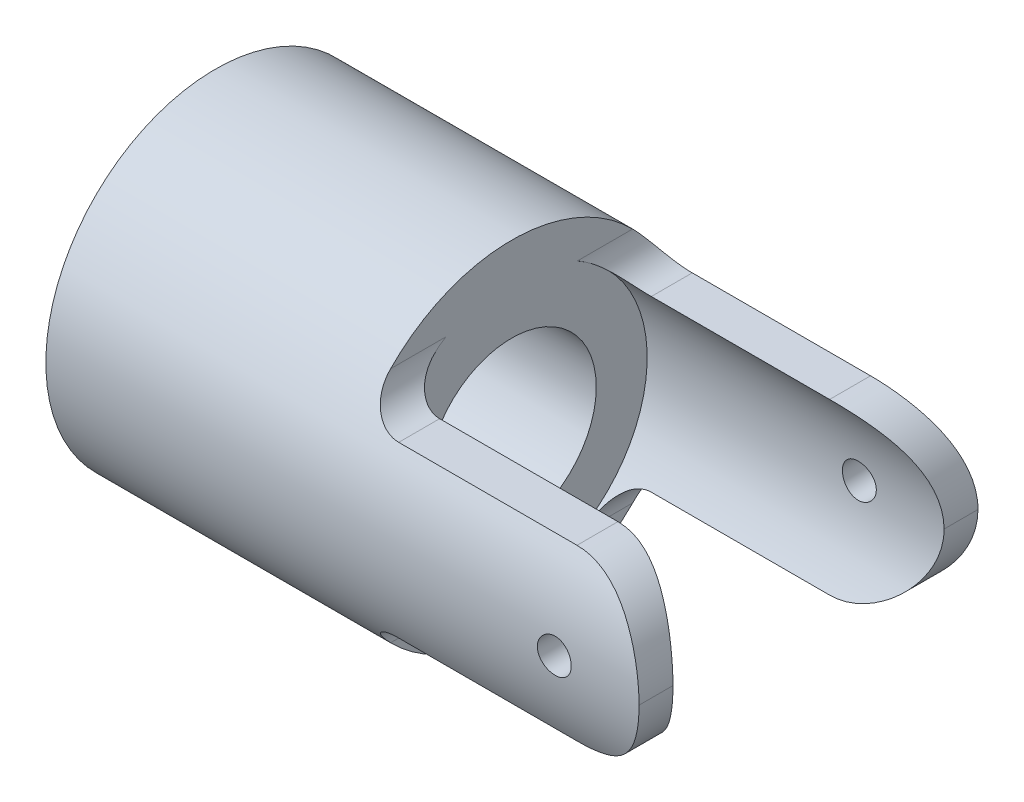
from build123d import *
from build123d.topology import SkipClean

# Parameters (mm, degrees)
SKETCH1_R                   = 6.35
FLANGE_BOTTOM_DEPTH         = 7.9248
SKETCH2_R                   = 6.35
FLANGMIDBODY_DEPTH          = 3.175
FLANGELEGS_DEPTH            = 11.1252
FILLET1_R                   = 3.175
LOCKINGSHAFTHOLE_DEPTH      = 22.060567449
LOCKINGSHAFTHOLE_DEPTH_BACK = 22.060567449
SKETCH4_R                   = 0.635
FILLET3_R                   = 1.27
SKETCH5_R                   = 3.17246
CENTERSHAFTHOLE_DEPTH       = 24.970724451
SKETCH10_R                  = 0.889
SET_SCREW_DEPTH             = 22.060567449
SKETCH11_R                  = 0.889
SUB_DRILL_DEPTH             = 1.27


# Some blends are built 0.0001 mm under size
with BuildPart() as part:
    # Sketch1 → Flange Bottom (new body)
    with BuildSketch(Plane(origin=(-19.05, 0, 0), x_dir=(0, 0, -1), z_dir=(1, 0, 0))):
        Circle(SKETCH1_R)
    extrude(amount=FLANGE_BOTTOM_DEPTH)

    # Sketch2 → Flangmidbody (add)
    with BuildSketch(Plane(origin=(-11.1252, 0, 0), x_dir=(0, 0, -1), z_dir=(1, 0, 0))):
        Circle(SKETCH2_R)
    extrude(amount=FLANGMIDBODY_DEPTH)

    # Sketch3 → Flangelegs (add)
    with SkipClean():  # the faces are left unmerged after this step: merging them gives an invalid solid
        with BuildSketch(Plane(origin=(-7.9502, 0, 0), x_dir=(0, 0, -1), z_dir=(1, 0, 0))):
            with BuildLine():
                Line((-5.499261314, 3.175), (-3.965573729, 3.175))
                ThreePointArc((-3.965573729, 3.175), (-5.08, 0), (-3.965573729, -3.175))
                Line((-3.965573729, -3.175), (-5.499261314, -3.175))
                ThreePointArc((-5.499261314, -3.175), (-6.35, 0), (-5.499261314, 3.175))
            make_face()
            with BuildLine():
                Line((3.965573729, 3.175), (5.499261314, 3.175))
                ThreePointArc((5.499261314, 3.175), (6.35, 0), (5.499261314, -3.175))
                Line((5.499261314, -3.175), (3.965573729, -3.175))
                ThreePointArc((3.965573729, -3.175), (5.08, 0), (3.965573729, 3.175))
            make_face()
        extrude(amount=FLANGELEGS_DEPTH)

    # Fillet1
    fillet1_edges = [part.edges().sort_by_distance(p)[0] for p in [
        (3.175, -3.175, -4.732417522),
        (3.175, 3.175, -4.732417522),
        (3.175, -3.175, 4.732417522),
        (3.175, 3.175, 4.732417522),
    ]]
    fillet(fillet1_edges, radius=FILLET1_R - 0.0001)  # a hair under: the kernel refuses the full size

    # Sketch4 → Lockingshafthole (cut, two sides: drawn at the far end of the back side and taken through both)
    with BuildSketch(Plane.XY.offset(-LOCKINGSHAFTHOLE_DEPTH_BACK)):
        Circle(SKETCH4_R)
    extrude(amount=LOCKINGSHAFTHOLE_DEPTH + LOCKINGSHAFTHOLE_DEPTH_BACK, mode=Mode.SUBTRACT)

    # Fillet3
    # the kernel refuses this fillet: 1.27 mm, written as the material it adds along each edge
    with BuildSketch(Plane(origin=(-7.9502, 3.175, -0.790573729), x_dir=(1, 0, 0), z_dir=(0, 0, -1))) as fillet3_piece_1_section:
        with BuildLine():
            CenterArc((FILLET3_R, -FILLET3_R), FILLET3_R, 90, 90)
            Line((0, -FILLET3_R), (0, 0))
            Line((0, 0), (FILLET3_R, 0))
        make_face()
    fillet3_piece_1 = extrude(amount=7.883687585, mode=Mode.PRIVATE)
    fillet3_piece_1 = fillet3_piece_1 & Plane(origin=(-7.671308244, 0, 0), x_dir=(0, 0.4999999999999997, -0.8660254037844388), z_dir=(-1, 0, 0)) * Cylinder(6.35, 21, mode=Mode.PRIVATE)
    fillet3_piece_1 = fillet3_piece_1 - Plane(origin=(-7.671308244, 0, 0), x_dir=(0, -0.6249999999999998, -0.7806247497997999), z_dir=(-1, 0, 0)) * Cylinder(5.08, 21, mode=Mode.PRIVATE)
    add(fillet3_piece_1)
    with BuildSketch(Plane(origin=(-7.9502, -3.175, -8.674261314), x_dir=(1, 0, 0), z_dir=(0, 0, 1))) as fillet3_piece_2_section:
        with BuildLine():
            CenterArc((FILLET3_R, -FILLET3_R), FILLET3_R, 90, 90)
            Line((0, -FILLET3_R), (0, 0))
            Line((0, 0), (FILLET3_R, 0))
        make_face()
    fillet3_piece_2 = extrude(amount=7.883687585, mode=Mode.PRIVATE)
    fillet3_piece_2 = fillet3_piece_2 & Plane(origin=(-7.671308757, 0, 0), x_dir=(0, 0.4999999999999997, -0.8660254037844388), z_dir=(-1, 0, 0)) * Cylinder(6.35, 21, mode=Mode.PRIVATE)
    fillet3_piece_2 = fillet3_piece_2 - Plane(origin=(-7.671308757, 0, 0), x_dir=(0, -0.6249999999999998, -0.7806247497997999), z_dir=(-1, 0, 0)) * Cylinder(5.08, 21, mode=Mode.PRIVATE)
    add(fillet3_piece_2)
    with BuildSketch(Plane(origin=(-7.9502, -3.175, 0.790573729), x_dir=(0, -1, 0), z_dir=(0, 0, 1))) as fillet3_piece_3_section:
        with BuildLine():
            CenterArc((FILLET3_R, FILLET3_R), FILLET3_R, 180, 90)
            Line((0, FILLET3_R), (0, 0))
            Line((0, 0), (FILLET3_R, 0))
        make_face()
    fillet3_piece_3 = extrude(amount=7.883687585, mode=Mode.PRIVATE)
    fillet3_piece_3 = fillet3_piece_3 & Plane(origin=(-7.671308363, 0, 0), x_dir=(0, 0, -1), z_dir=(-1, 0, 0)) * Cylinder(6.35, 21, mode=Mode.PRIVATE)
    fillet3_piece_3 = fillet3_piece_3 - Plane(origin=(-7.671308363, 0, 0), x_dir=(0, 0.6250000000000004, 0.7806247497997995), z_dir=(-1, 0, 0)) * Cylinder(5.08, 21, mode=Mode.PRIVATE)
    add(fillet3_piece_3)
    with BuildSketch(Plane(origin=(-7.9502, 3.175, 8.674261314), x_dir=(0, 1, 0), z_dir=(0, 0, -1))) as fillet3_piece_4_section:
        with BuildLine():
            CenterArc((FILLET3_R, FILLET3_R), FILLET3_R, 180, 90)
            Line((0, FILLET3_R), (0, 0))
            Line((0, 0), (FILLET3_R, 0))
        make_face()
    fillet3_piece_4 = extrude(amount=7.883687585, mode=Mode.PRIVATE)
    fillet3_piece_4 = fillet3_piece_4 & Plane(origin=(-7.671308731, 0, 0), x_dir=(0, 0, -1), z_dir=(-1, 0, 0)) * Cylinder(6.35, 21, mode=Mode.PRIVATE)
    fillet3_piece_4 = fillet3_piece_4 - Plane(origin=(-7.671308731, 0, 0), x_dir=(0, 0.6250000000000004, 0.7806247497997995), z_dir=(-1, 0, 0)) * Cylinder(5.08, 21, mode=Mode.PRIVATE)
    add(fillet3_piece_4)

    # Sketch5 → CenterShaftHole (cut, through all)
    with BuildSketch(Plane.ZY.offset(19.05)):
        Circle(SKETCH5_R)
    extrude(amount=-CENTERSHAFTHOLE_DEPTH, mode=Mode.SUBTRACT)

    # Sketch10 → SET SCREW (cut, through all)
    with BuildSketch(Plane(origin=(0, 0, 0), x_dir=(1, 0, 0), z_dir=(0, 1, 0))):
        with Locations(Location((-15.24, 0, 0), (0, 0, 270))):
            Circle(SKETCH10_R)
    extrude(amount=-SET_SCREW_DEPTH, mode=Mode.SUBTRACT)

    # Sketch11 → SUB DRILL (cut)
    with BuildSketch(Plane.XY.offset(-6.35)):
        with Locations((-15.24, 0)):
            Circle(SKETCH11_R)
    extrude(amount=SUB_DRILL_DEPTH, mode=Mode.SUBTRACT)


solid = part.part
